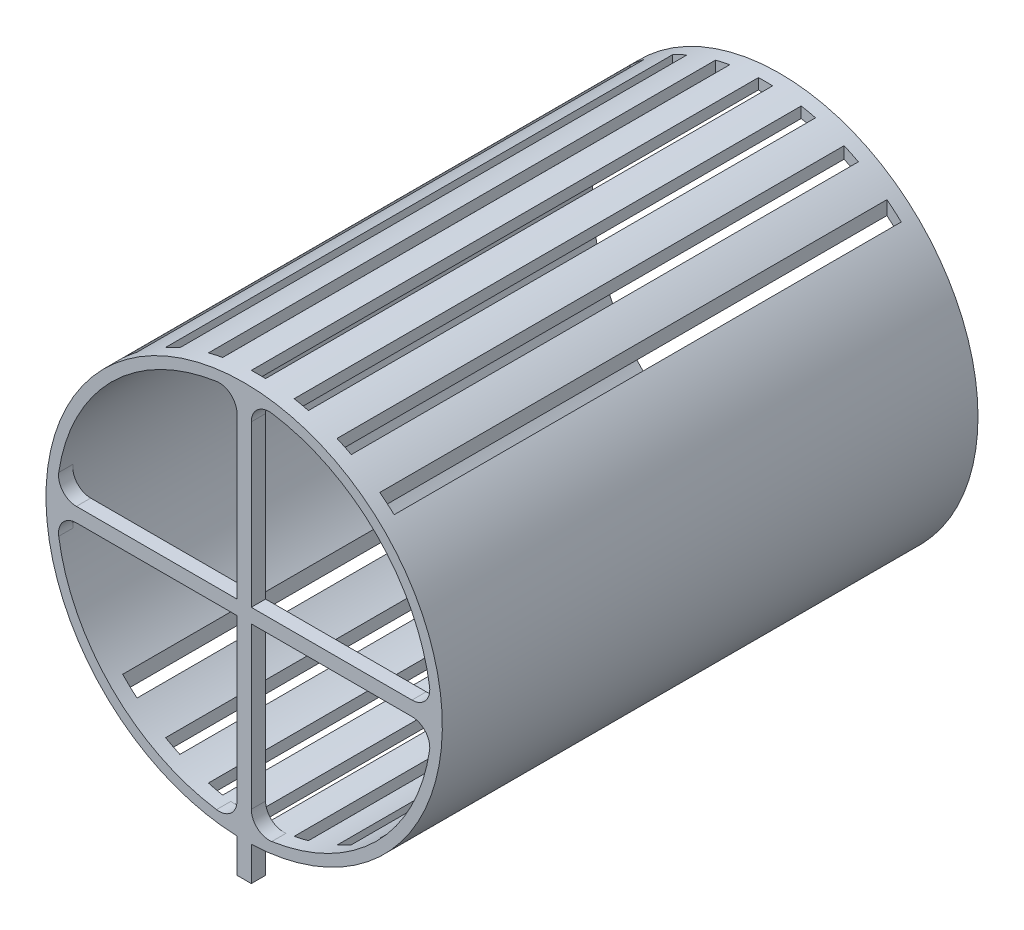
from build123d import *

# Parameters (mm, degrees)
SKETCH1_R           = 55.5
SKETCH1_R_2         = 52.5
BOSS_EXTRUDE1_DEPTH = 150
SKETCH2_W           = 4
SKETCH2_H           = 142
CUT_EXTRUDE1_DEPTH  = 150
BOSS_EXTRUDE2_DEPTH = 4
FILLET1_R           = 5
SKETCH5_W           = 4
SKETCH5_H           = 20.826231377
BOSS_EXTRUDE5_DEPTH = 4


with BuildPart() as part:
    # Sketch1 → Boss-Extrude1 (new body)
    with BuildSketch(Plane.XY):
        Circle(SKETCH1_R)
        Circle(SKETCH1_R_2, mode=Mode.SUBTRACT)
    extrude(amount=BOSS_EXTRUDE1_DEPTH)

    # Sketch2 → Cut-Extrude1 (cut)
    with BuildSketch(Plane(origin=(0, 60, 0), x_dir=(1, 0, 0), z_dir=(0, 1, 0))):
        with Locations((0, -75)):
            Rectangle(SKETCH2_W, SKETCH2_H)
        with Locations((12, -75)):
            Rectangle(SKETCH2_W, SKETCH2_H)
        with Locations((-12, -75)):
            Rectangle(SKETCH2_W, SKETCH2_H)
        with Locations((-24, -75)):
            Rectangle(SKETCH2_W, SKETCH2_H)
        with Locations((24, -75)):
            Rectangle(SKETCH2_W, SKETCH2_H)
        with Locations((-36, -75)):
            Rectangle(SKETCH2_W, SKETCH2_H)
        with Locations((36, -75)):
            Rectangle(SKETCH2_W, SKETCH2_H)
    extrude(amount=-CUT_EXTRUDE1_DEPTH, mode=Mode.SUBTRACT)

    # Sketch3 → Boss-Extrude2 (add)
    with BuildSketch(Plane.XY.offset(150)):
        Polygon((2, 2), (53.813508097, 2), (53.813508097, -2), (2, -2), (2, -53.914352019), (-2, -53.914352019), (-2, -2), (-54.055297176, -2), (-54.055297176, 2), (-2, 2), (-2, 53.801230519), (2, 53.801230519), align=None)
    extrude(amount=-BOSS_EXTRUDE2_DEPTH)

    # Fillet1
    fillet1_edges = [part.edges().sort_by_distance(p)[0] for p in [
        (-2, -52.46189093, 148),
        (2, -52.46189093, 148),
        (-2, 52.46189093, 148),
        (2, 52.46189093, 148),
        (52.46189093, 2, 148),
        (52.46189093, -2, 148),
        (-52.46189093, -2, 148),
        (-52.46189093, 2, 148),
    ]]
    fillet(fillet1_edges, radius=FILLET1_R)

    # Sketch5 → Boss-Extrude5 (add)
    with BuildSketch(Plane.XY.offset(150)):
        with Locations((0, -54.586884312)):
            Rectangle(SKETCH5_W, SKETCH5_H)
    extrude(amount=-BOSS_EXTRUDE5_DEPTH)


solid = part.part
